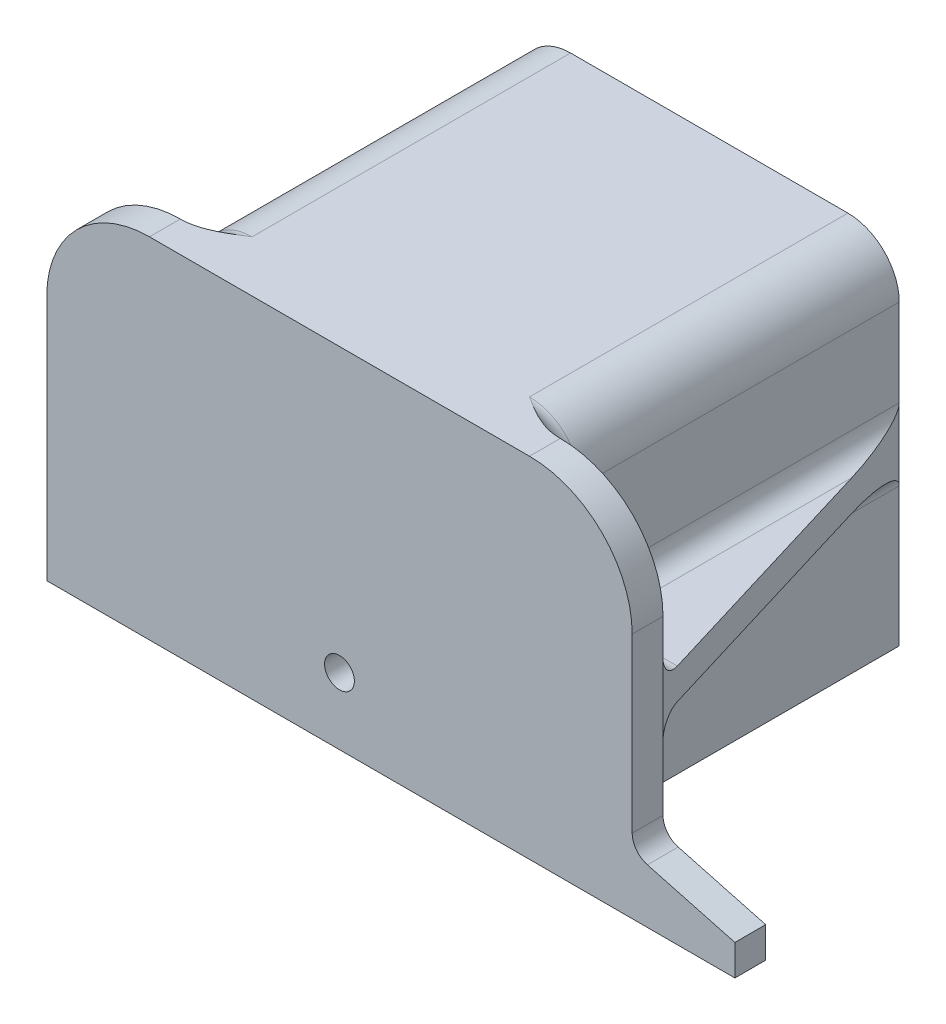
from build123d import *

# Parameters (mm, degrees)
BOSS_EXTRUDE1_DEPTH = 17
BOSS_EXTRUDE2_DEPTH = 1.5
SKETCH3_R           = 1.45
CUT_EXTRUDE1_DEPTH  = 45.735332792
FILLET1_R           = 10
SKETCH4_R           = 5
CUT_EXTRUDE4_DEPTH  = 2
FILLET2_R           = 0.5
SKETCH5_W           = 31
SKETCH5_H           = 3
BOSS_EXTRUDE3_DEPTH = 30
SKETCH6_W           = 3
SKETCH6_H           = 3
BOSS_EXTRUDE4_DEPTH = 10
CHAMFER1_SIZE2      = 10
CHAMFER1_SIZE       = 2.679491924
FILLET3_R           = 5
FILLET4_R           = 2


# Some blends are built 0.0001 mm under size
with BuildPart() as part:
    # Sketch1 → Boss-Extrude1 (new, symmetric)
    with BuildSketch(Plane(origin=(0, 0, 0), x_dir=(1, 0, 0), z_dir=(0, 1, 0))):
        Polygon((15.5, 0), (-15.5, 0), (-15.5, 30), (-18.5, 30), (-18.5, -3), (-28.5, -3), (-28.5, -6), (28.5, -6), (28.5, -3), (18.5, -3), (18.5, 30), (15.5, 30), align=None)
    extrude(amount=BOSS_EXTRUDE1_DEPTH, both=True)

    # Sketch2 → Boss-Extrude2 (add, symmetric)
    with BuildSketch(Plane(origin=(0, 0, 0), x_dir=(1, 0, 0), z_dir=(0, 1, 0))):
        Polygon((18.5, 30), (18.5, -3), (28.5, -3), align=None)
    boss_extrude2 = extrude(amount=BOSS_EXTRUDE2_DEPTH, both=True)

    # Mirror1: Boss-Extrude2 across plane
    add(boss_extrude2.mirror(Plane(origin=(0, 0, 0), x_dir=(0, 0, 1), z_dir=(1, 0, 0))))

    # Sketch3 → Cut-Extrude1 (cut, through all)
    with BuildSketch(Plane(origin=(0, 0, 0), x_dir=(-1, 0, 0), z_dir=(0, 0, -1))):
        with Locations((0, -10.5)):
            Circle(SKETCH3_R)
    extrude(amount=-CUT_EXTRUDE1_DEPTH, mode=Mode.SUBTRACT)

    # Fillet1
    fillet1_edges = [part.edges().sort_by_distance(p)[0] for p in [
        (28.5, 17, 4.5),
        (-28.5, 17, 4.5),
    ]]
    fillet(fillet1_edges, radius=FILLET1_R)

    # Sketch4 → Cut-Extrude4 (cut)
    with BuildSketch(Plane(origin=(0, 0, 0), x_dir=(-1, 0, 0), z_dir=(0, 0, -1))):
        with Locations((0, -10.5)):
            Circle(SKETCH4_R)
    extrude(amount=-CUT_EXTRUDE4_DEPTH, mode=Mode.SUBTRACT)

    # Fillet2
    fillet2_edges = [part.edges().sort_by_distance(p)[0] for p in [
        (5, -10.5, 2),
    ]]
    fillet(fillet2_edges, radius=FILLET2_R)

    # Sketch5 → Boss-Extrude3 (add)
    with BuildSketch(Plane(origin=(0, 0, 0), x_dir=(-1, 0, 0), z_dir=(0, 0, -1))):
        with Locations((0, 15.5)):
            Rectangle(SKETCH5_W, SKETCH5_H)
    extrude(amount=BOSS_EXTRUDE3_DEPTH)

    # Sketch6 → Boss-Extrude4 (add)
    with BuildSketch(Plane(origin=(28.5, 0, 0), x_dir=(0, 0, -1), z_dir=(1, 0, 0))):
        with Locations((-4.5, -15.5)):
            Rectangle(SKETCH6_W, SKETCH6_H)
    extrude(amount=BOSS_EXTRUDE4_DEPTH)

    # Chamfer1
    chamfer1_edges = [part.edges().sort_by_distance(p)[0] for p in [
        (28.5, -14, 4.5),
    ]]
    chamfer1_side = [part.faces().sort_by_distance(p)[0] for p in [
        (28.5, -13.946410162, 4.5),
    ]]
    chamfer(chamfer1_edges, length=CHAMFER1_SIZE - 0.0001, length2=CHAMFER1_SIZE2 - 0.0001, reference=chamfer1_side[0])  # a hair under: the kernel refuses the full size

    # Fillet3
    fillet3_edges = [part.edges().sort_by_distance(p)[0] for p in [
        (18.5, 17, -13.5),
        (15.5, 14, -15),
        (-18.5, 17, -13.5),
        (-15.5, 14, -15),
    ]]
    fillet(fillet3_edges, radius=FILLET3_R)

    # Fillet4
    # the kernel refuses this fillet: 2 mm, written as the material it adds along each edge
    with BuildSketch(Plane(origin=(-20.5, 3.5, 1), x_dir=(0, 0, 1), z_dir=(1, 0, 0))) as fillet4_piece_1_section:
        Polygon((0, 0), (FILLET4_R * 1.02, 0), (FILLET4_R * 1.02, FILLET4_R * 1.02), (0, FILLET4_R * 1.02), align=None)
    fillet4_piece_1 = extrude(amount=FILLET4_R * 1.02, mode=Mode.PRIVATE)
    fillet4_piece_1 = fillet4_piece_1 - Plane(origin=(-20.5, 3.5, 1), x_dir=(0, 0.7071067811865475, -0.7071067811865475), z_dir=(1, 0, 0)) * Sphere(FILLET4_R, mode=Mode.PRIVATE)
    add(fillet4_piece_1)
    with BuildSketch(Plane(origin=(20.5, 3.5, 1), x_dir=(-1, 0, 0), z_dir=(0, 0, 1))) as fillet4_piece_2_section:
        Polygon((0, 0), (FILLET4_R * 1.02, 0), (FILLET4_R * 1.02, FILLET4_R * 1.02), (0, FILLET4_R * 1.02), align=None)
    fillet4_piece_2 = extrude(amount=FILLET4_R * 1.02, mode=Mode.PRIVATE)
    fillet4_piece_2 = fillet4_piece_2 - Plane(origin=(20.5, 3.5, 1), x_dir=(0.7071067811865475, 0.7071067811865475, 0), z_dir=(0, 0, 1)) * Sphere(FILLET4_R, mode=Mode.PRIVATE)
    add(fillet4_piece_2)
    with BuildSketch(Plane(origin=(20.5, -3.5, 1), x_dir=(-1, 0, 0), z_dir=(0, 1, 0))) as fillet4_piece_3_section:
        Polygon((0, 0), (FILLET4_R * 1.02, 0), (FILLET4_R * 1.02, FILLET4_R * 1.02), (0, FILLET4_R * 1.02), align=None)
    fillet4_piece_3 = extrude(amount=FILLET4_R * 1.02, mode=Mode.PRIVATE)
    fillet4_piece_3 = fillet4_piece_3 - Plane(origin=(20.5, -3.5, 1), x_dir=(0.7071067811865474, 0, -0.7071067811865477), z_dir=(0, 1, 0)) * Sphere(FILLET4_R, mode=Mode.PRIVATE)
    add(fillet4_piece_3)
    with BuildSketch(Plane(origin=(-20.5, -3.5, 1), x_dir=(0, 1, 0), z_dir=(0, 0, 1))) as fillet4_piece_4_section:
        Polygon((0, 0), (FILLET4_R * 1.02, 0), (FILLET4_R * 1.02, -FILLET4_R * 1.02), (0, -FILLET4_R * 1.02), align=None)
    fillet4_piece_4 = extrude(amount=FILLET4_R * 1.02, mode=Mode.PRIVATE)
    fillet4_piece_4 = fillet4_piece_4 - Plane(origin=(-20.5, -3.5, 1), x_dir=(-0.7071067811865475, -0.7071067811865475, 0), z_dir=(0, 0, 1)) * Sphere(FILLET4_R, mode=Mode.PRIVATE)
    add(fillet4_piece_4)
    with BuildSketch(Plane(origin=(28.5, -11.320608076, 3), x_dir=(0, 1, 0), z_dir=(0, 0, 1))) as fillet4_piece_5:
        with BuildLine():
            CenterArc((FILLET4_R * 0.767332413902, -FILLET4_R), FILLET4_R, 90, 75.000391344)
            Line((-FILLET4_R * 0.19859518016, -FILLET4_R * 0.741187552406), (0, 0))
            Line((0, 0), (FILLET4_R * 0.767332413902, 0))
        make_face()
    extrude(amount=3)
    with BuildSketch(Plane(origin=(-18.5, 3.5, 3), x_dir=(-1, 0, 0), z_dir=(0, 1, 0))) as fillet4_piece_6:
        with BuildLine():
            CenterArc((FILLET4_R, -FILLET4_R), FILLET4_R, 90, 90)
            Line((0, -FILLET4_R), (0, 0))
            Line((0, 0), (FILLET4_R, 0))
        make_face()
    extrude(amount=8.5)
    with BuildSketch(Plane(origin=(18.5, 3.5, 3), x_dir=(1, 0, 0), z_dir=(0, 1, 0))) as fillet4_piece_7:
        with BuildLine():
            CenterArc((FILLET4_R, FILLET4_R), FILLET4_R, 180, 90)
            Line((0, FILLET4_R), (0, 0))
            Line((0, 0), (FILLET4_R, 0))
        make_face()
    extrude(amount=8.5)
    with BuildSketch(Plane(origin=(-13.5, 12, 3), x_dir=(0.8416879607506226, 0.5399642365263262, 0), z_dir=(0.5399642365263262, -0.8416879607506226, 0))) as fillet4_piece_8_section:
        with BuildLine():
            CenterArc((5 + FILLET4_R, -FILLET4_R), FILLET4_R, 90, 90)
            Line((5 + FILLET4_R, 0), (5, 0))
            Line((5, 0), (5, -FILLET4_R))
        make_face()
    fillet4_piece_8 = revolve(axis=Axis((-13.5, 12, 3), (0, 0, 1)), revolution_arc=147.318795695, mode=Mode.PRIVATE)
    fillet4_piece_8 = split(fillet4_piece_8, bisect_by=Plane(origin=(-17.113068515, 17, 2.473069622), z_dir=(0, -1, 0)), keep=Keep.TOP, mode=Mode.PRIVATE)
    add(fillet4_piece_8)
    with BuildSketch(Plane(origin=(13.5, 12, 3), x_dir=(-0.8416879607506225, 0.5399642365263265, 0), z_dir=(-0.5399642365263265, -0.8416879607506225, 0))) as fillet4_piece_9_section:
        with BuildLine():
            CenterArc((5 + FILLET4_R, FILLET4_R), FILLET4_R, 180, 90)
            Line((5, FILLET4_R), (5, 0))
            Line((5, 0), (5 + FILLET4_R, 0))
        make_face()
    fillet4_piece_9 = revolve(axis=Axis((13.5, 12, 3), (0, 0, -1)), revolution_arc=147.318795695, mode=Mode.PRIVATE)
    fillet4_piece_9 = split(fillet4_piece_9, bisect_by=Plane(origin=(17.113068943, 17, 2.473070036), z_dir=(0, -1, 0)), keep=Keep.TOP, mode=Mode.PRIVATE)
    add(fillet4_piece_9)
    with BuildSketch(Plane(origin=(18.5, -17, 3), x_dir=(1, 0, 0), z_dir=(0, 1, 0)), Plane(origin=(-18.5, -17, 3), x_dir=(0, 0, -1), z_dir=(0, 1, 0))) as fillet4_piece_10:
        with BuildLine():
            CenterArc((FILLET4_R, FILLET4_R), FILLET4_R, 180, 90)
            Line((0, FILLET4_R), (0, 0))
            Line((0, 0), (FILLET4_R, 0))
        make_face()
    extrude(amount=13.5)
    with BuildSketch(Plane(origin=(18.5, -1.5, -35), x_dir=(0, -1, 0), z_dir=(0, 0, 1))) as fillet4_piece_11_section:
        with BuildLine():
            CenterArc((FILLET4_R, FILLET4_R), FILLET4_R, 180, 90)
            Line((0, FILLET4_R), (0, 0))
            Line((0, 0), (FILLET4_R, 0))
        make_face()
    fillet4_piece_11 = extrude(amount=36, mode=Mode.PRIVATE)
    fillet4_piece_11 = split(fillet4_piece_11, bisect_by=Plane(origin=(23.03556841, -1.955982706, -15.032624248), z_dir=(-0.9570244044334735, 0, 0.290007395282871)), keep=Keep.TOP, mode=Mode.PRIVATE)
    add(fillet4_piece_11)
    with BuildSketch(Plane(origin=(20.5, -1.5, 3), x_dir=(0, -1, 0), z_dir=(1, 0, 0))) as fillet4_piece_12_section:
        with BuildLine():
            CenterArc((FILLET4_R, FILLET4_R), FILLET4_R, 180, 90)
            Line((0, FILLET4_R), (0, 0))
            Line((0, 0), (FILLET4_R, 0))
        make_face()
    fillet4_piece_12 = extrude(amount=13, mode=Mode.PRIVATE)
    fillet4_piece_12 = split(fillet4_piece_12, bisect_by=Plane(origin=(28.035474122, -1.949923656, 1.467064601), z_dir=(-0.9570244044334735, 0, 0.290007395282871)), keep=Keep.TOP, mode=Mode.PRIVATE)
    add(fillet4_piece_12)
    with BuildSketch(Plane(origin=(18.5, 1.5, -35), x_dir=(0, 1, 0), z_dir=(0, 0, 1))) as fillet4_piece_13_section:
        with BuildLine():
            CenterArc((FILLET4_R, -FILLET4_R), FILLET4_R, 90, 90)
            Line((0, -FILLET4_R), (0, 0))
            Line((0, 0), (FILLET4_R, 0))
        make_face()
    fillet4_piece_13 = extrude(amount=36, mode=Mode.PRIVATE)
    fillet4_piece_13 = split(fillet4_piece_13, bisect_by=Plane(origin=(23.03556841, 1.955982706, -15.032624248), z_dir=(-0.9570244044334735, 0, 0.290007395282871)), keep=Keep.TOP, mode=Mode.PRIVATE)
    add(fillet4_piece_13)
    with BuildSketch(Plane(origin=(20.5, 1.5, 3), x_dir=(0, 1, 0), z_dir=(1, 0, 0))) as fillet4_piece_14_section:
        with BuildLine():
            CenterArc((FILLET4_R, -FILLET4_R), FILLET4_R, 90, 90)
            Line((0, -FILLET4_R), (0, 0))
            Line((0, 0), (FILLET4_R, 0))
        make_face()
    fillet4_piece_14 = extrude(amount=13, mode=Mode.PRIVATE)
    fillet4_piece_14 = split(fillet4_piece_14, bisect_by=Plane(origin=(28.035474122, 1.949923656, 1.467064601), z_dir=(-0.9570244044334735, 0, 0.290007395282871)), keep=Keep.TOP, mode=Mode.PRIVATE)
    add(fillet4_piece_14)
    with BuildSketch(Plane(origin=(-20.5, 1.5, 3), x_dir=(0, 1, 0), z_dir=(-1, 0, 0))) as fillet4_piece_15_section:
        with BuildLine():
            CenterArc((FILLET4_R, FILLET4_R), FILLET4_R, 180, 90)
            Line((0, FILLET4_R), (0, 0))
            Line((0, 0), (FILLET4_R, 0))
        make_face()
    fillet4_piece_15 = extrude(amount=13, mode=Mode.PRIVATE)
    fillet4_piece_15 = split(fillet4_piece_15, bisect_by=Plane(origin=(-28.035474122, 1.949923656, 1.467064601), z_dir=(0.9570244044334735, 0, 0.290007395282871)), keep=Keep.TOP, mode=Mode.PRIVATE)
    add(fillet4_piece_15)
    with BuildSketch(Plane(origin=(-18.5, 1.5, -35), x_dir=(0, 1, 0), z_dir=(0, 0, 1))) as fillet4_piece_16_section:
        with BuildLine():
            CenterArc((FILLET4_R, FILLET4_R), FILLET4_R, 180, 90)
            Line((0, FILLET4_R), (0, 0))
            Line((0, 0), (FILLET4_R, 0))
        make_face()
    fillet4_piece_16 = extrude(amount=36, mode=Mode.PRIVATE)
    fillet4_piece_16 = split(fillet4_piece_16, bisect_by=Plane(origin=(-23.03556841, 1.955982706, -15.032624248), z_dir=(0.9570244044334735, 0, 0.290007395282871)), keep=Keep.TOP, mode=Mode.PRIVATE)
    add(fillet4_piece_16)
    with BuildSketch(Plane(origin=(-18.5, -1.5, -35), x_dir=(0, -1, 0), z_dir=(0, 0, 1))) as fillet4_piece_17_section:
        with BuildLine():
            CenterArc((FILLET4_R, -FILLET4_R), FILLET4_R, 90, 90)
            Line((0, -FILLET4_R), (0, 0))
            Line((0, 0), (FILLET4_R, 0))
        make_face()
    fillet4_piece_17 = extrude(amount=36, mode=Mode.PRIVATE)
    fillet4_piece_17 = split(fillet4_piece_17, bisect_by=Plane(origin=(-23.03556841, -1.955982706, -15.032624248), z_dir=(0.9570244044334735, 0, 0.290007395282871)), keep=Keep.TOP, mode=Mode.PRIVATE)
    add(fillet4_piece_17)
    with BuildSketch(Plane(origin=(-20.5, -1.5, 3), x_dir=(0, -1, 0), z_dir=(-1, 0, 0))) as fillet4_piece_18_section:
        with BuildLine():
            CenterArc((FILLET4_R, -FILLET4_R), FILLET4_R, 90, 90)
            Line((0, -FILLET4_R), (0, 0))
            Line((0, 0), (FILLET4_R, 0))
        make_face()
    fillet4_piece_18 = extrude(amount=13, mode=Mode.PRIVATE)
    fillet4_piece_18 = split(fillet4_piece_18, bisect_by=Plane(origin=(-28.035474122, -1.949923656, 1.467064601), z_dir=(0.9570244044334735, 0, 0.290007395282871)), keep=Keep.TOP, mode=Mode.PRIVATE)
    add(fillet4_piece_18)


solid = part.part
